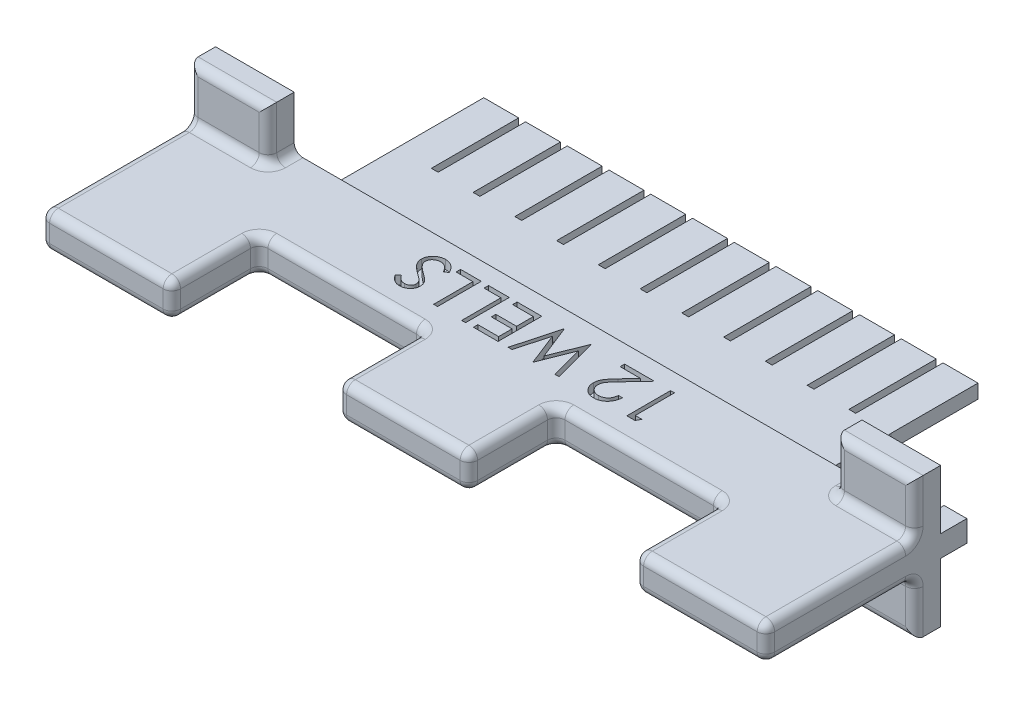
from build123d import *

# Parameters (mm, degrees)
SKETCH1_W           = 83
SKETCH1_H           = 4
BOSS_EXTRUDE1_DEPTH = 10
SKETCH2_W           = 15
SKETCH2_H           = 4
BOSS_EXTRUDE2_DEPTH = 10
SKETCH3_W           = 2.6
SKETCH3_H           = 2.45
BOSS_EXTRUDE3_DEPTH = 3
SKETCH4_W           = 56.6
SKETCH4_H           = 1.6
BOSS_EXTRUDE4_DEPTH = 7.5
SKETCH5_W           = 4
SKETCH5_H           = 1.6
BOSS_EXTRUDE5_DEPTH = 10
SKETCH6_W           = 9
SKETCH6_H           = 6
BOSS_EXTRUDE6_DEPTH = 3
FILLET1_R           = 1
CUT_EXTRUDE1_DEPTH  = 1


with BuildPart() as part:
    # Sketch1 → Boss-Extrude1 (new body)
    with BuildSketch(Plane.XY):
        Rectangle(SKETCH1_W, SKETCH1_H)
    extrude(amount=BOSS_EXTRUDE1_DEPTH)

    # Sketch2 → Boss-Extrude2 (add)
    with BuildSketch(Plane.XY.offset(10)):
        with Locations((-34, 0)):
            Rectangle(SKETCH2_W, SKETCH2_H)
        with Locations((34, 0)):
            Rectangle(SKETCH2_W, SKETCH2_H)
        Rectangle(SKETCH2_W, SKETCH2_H)
    extrude(amount=BOSS_EXTRUDE2_DEPTH)

    # Sketch3 → Boss-Extrude3 (add)
    with BuildSketch(Plane(origin=(0, 0, 0), x_dir=(-1, 0, 0), z_dir=(0, 0, -1))):
        with Locations((40.2, 0)):
            Rectangle(SKETCH3_W, SKETCH3_H)
        with Locations((-40.2, 0)):
            Rectangle(SKETCH3_W, SKETCH3_H)
    extrude(amount=BOSS_EXTRUDE3_DEPTH)

    # Sketch4 → Boss-Extrude4 (add)
    with BuildSketch(Plane(origin=(0, 0, 0), x_dir=(-1, 0, 0), z_dir=(0, 0, -1))):
        Rectangle(SKETCH4_W, SKETCH4_H)
    extrude(amount=BOSS_EXTRUDE4_DEPTH)

    # Sketch5 → Boss-Extrude5 (add)
    with BuildSketch(Plane(origin=(0, 0, -7.5), x_dir=(-1, 0, 0), z_dir=(0, 0, -1))):
        with Locations((26.3, 0)):
            Rectangle(SKETCH5_W, SKETCH5_H)
        with Locations((21.52, 0)):
            Rectangle(SKETCH5_W, SKETCH5_H)
        with Locations((16.74, 0)):
            Rectangle(SKETCH5_W, SKETCH5_H)
        with Locations((11.96, 0)):
            Rectangle(SKETCH5_W, SKETCH5_H)
        with Locations((7.18, 0)):
            Rectangle(SKETCH5_W, SKETCH5_H)
        with Locations((2.4, 0)):
            Rectangle(SKETCH5_W, SKETCH5_H)
        with Locations((-2.38, 0)):
            Rectangle(SKETCH5_W, SKETCH5_H)
        with Locations((-7.16, 0)):
            Rectangle(SKETCH5_W, SKETCH5_H)
        with Locations((-11.94, 0)):
            Rectangle(SKETCH5_W, SKETCH5_H)
        with Locations((-16.72, 0)):
            Rectangle(SKETCH5_W, SKETCH5_H)
        with Locations((-21.5, 0)):
            Rectangle(SKETCH5_W, SKETCH5_H)
        with Locations((-26.28, 0)):
            Rectangle(SKETCH5_W, SKETCH5_H)
    extrude(amount=BOSS_EXTRUDE5_DEPTH)

    # Sketch6 → Boss-Extrude6 (add)
    with BuildSketch(Plane(origin=(0, 0, 0), x_dir=(-1, 0, 0), z_dir=(0, 0, -1))):
        with Locations((37, -5)):
            Rectangle(SKETCH6_W, SKETCH6_H)
        with Locations((37, 5)):
            Rectangle(SKETCH6_W, SKETCH6_H)
        with Locations((-37, -5)):
            Rectangle(SKETCH6_W, SKETCH6_H)
        with Locations((-37, 5)):
            Rectangle(SKETCH6_W, SKETCH6_H)
    extrude(amount=-BOSS_EXTRUDE6_DEPTH)

    # Fillet1
    fillet1_edges = [part.edges().sort_by_distance(p)[0] for p in [
        (-41.5, -2, 11.5),
        (-32.5, -2, 1.5),
        (-37, -2, 3),
        (-32.5, -5, 3),
        (-37, -8, 3),
        (-41.5, -5, 3),
        (-26.5, 0, 20),
        (-34, -2, 20),
        (-41.5, 0, 20),
        (-34, 2, 20),
        (32.5, -2, 1.5),
        (41.5, -2, 11.5),
        (41.5, 2, 11.5),
        (32.5, 2, 1.5),
        (-32.5, 2, 1.5),
        (-41.5, 2, 11.5),
        (37, -8, 3),
        (32.5, -5, 3),
        (37, -2, 3),
        (41.5, -5, 3),
        (34, -2, 20),
        (26.5, 0, 20),
        (34, 2, 20),
        (41.5, 0, 20),
        (37, 2, 3),
        (32.5, 5, 3),
        (37, 8, 3),
        (41.5, 5, 3),
        (0, -2, 20),
        (-7.5, 0, 20),
        (0, 2, 20),
        (7.5, 0, 20),
        (-37, 8, 3),
        (-32.5, 5, 3),
        (-37, 2, 3),
        (-41.5, 5, 3),
        (26.5, 2, 15),
        (26.5, -2, 15),
        (26.5, 0, 10),
        (17, -2, 10),
        (17, 2, 10),
        (7.5, -2, 15),
        (7.5, 2, 15),
        (7.5, 0, 10),
        (-7.5, 2, 15),
        (-7.5, -2, 15),
        (-26.5, -2, 15),
        (-26.5, 2, 15),
        (-26.5, 0, 10),
        (-17, 2, 10),
        (-7.5, 0, 10),
        (-17, -2, 10),
    ]]
    fillet(fillet1_edges, radius=FILLET1_R)

    # Sketch8 → Cut-Extrude1 (cut)
    with BuildSketch(Plane(origin=(0, 2, 0), x_dir=(1, 0, 0), z_dir=(0, 1, 0))):
        Polygon((13.552684295, -7.045024133), (12.628205128, -7.045024133), (12.628205128, -2.045024133), (13.076923077, -2.045024133), (13.076923077, -6.53220362), (13.846153846, -6.53220362), align=None)
        with BuildLine():
            Line((10.128205128, -5.506562595), (10.576923077, -5.506562595))
            add(Edge.make_bspline(
                [(10.576923077, -5.506562595), (10.57399907, -5.566092728), (10.568256399, -5.683008325), (10.5413518, -5.853466896), (10.502890325, -6.016417351), (10.448381442, -6.170462688), (10.381067736, -6.317443109), (10.298656279, -6.455406883), (10.202903951, -6.585723285), (10.093986413, -6.705924992), (9.975800846, -6.815804382), (9.849055365, -6.911694974), (9.715052675, -6.99178619), (9.574955057, -7.059104705), (9.427142241, -7.109574069), (9.273027152, -7.147037958), (9.111913205, -7.169574394), (9.002141869, -7.17199711), (8.946314103, -7.173229261)],
                knots=[0, 0, 0, 0, 1.100776268, 2.161895295, 3.184016182, 4.190939212, 5.176500551, 6.166955529, 7.155448256, 8.160289653, 9.16017456, 10.133824356, 11.091467644, 12.04088621, 13.000931625, 13.972173743, 14.968683325, 16, 16, 16, 16], degree=3))
            add(Edge.make_bspline(
                [(8.946314103, -7.173229261), (8.891484424, -7.171956168), (8.783746065, -7.169454585), (8.626569197, -7.147648624), (8.47658477, -7.114232934), (8.335492555, -7.064716144), (8.201844549, -7.002583404), (8.077295538, -6.925313202), (7.958833795, -6.836561703), (7.852273217, -6.731874959), (7.75438447, -6.620173937), (7.670010289, -6.500878186), (7.597346581, -6.377522706), (7.537873605, -6.249143911), (7.492790445, -6.115323738), (7.459388144, -5.977345167), (7.440293583, -5.83361583), (7.437379152, -5.736317952), (7.435897436, -5.686851056)],
                knots=[0, 0, 0, 0, 1.111674182, 2.184400057, 3.212814286, 4.223731311, 5.211378316, 6.196328225, 7.191884489, 8.207283132, 9.220262353, 10.201199469, 11.166417575, 12.120932471, 13.06540007, 14.026332106, 14.996573967, 16, 16, 16, 16], degree=3))
            add(Edge.make_bspline(
                [(7.435897436, -5.686851056), (7.438316421, -5.617211323), (7.443111941, -5.479153934), (7.484131922, -5.276275119), (7.548200487, -5.079714765), (7.625332732, -4.921513227), (7.70316581, -4.794048875), (7.773234562, -4.68904921), (7.855728121, -4.576022551), (7.949941698, -4.454511424), (8.057497784, -4.326107119), (8.175602088, -4.188189845), (8.307304693, -4.043309786), (8.399659881, -3.944290287), (8.447516026, -3.892980864)],
                knots=[0, 0, 0, 0, 1.184416499, 2.348048165, 3.509039915, 4.696071444, 5.333504901, 6.05069495, 6.844171097, 7.714965912, 8.667477798, 9.695072654, 10.805644396, 12, 12, 12, 12], degree=3))
            Line((8.447516026, -3.892980864), (9.698517628, -2.557844646))
            Line((9.698517628, -2.557844646), (7.371794872, -2.557844646))
            Line((7.371794872, -2.557844646), (7.371794872, -2.045024133))
            Line((7.371794872, -2.045024133), (10.769230769, -2.045024133))
            Line((10.769230769, -2.045024133), (8.830128205, -4.114335031))
            add(Edge.make_bspline(
                [(8.830128205, -4.114335031), (8.782913596, -4.163615638), (8.692223994, -4.258273598), (8.564007146, -4.396513192), (8.448662561, -4.524609386), (8.346113726, -4.643129805), (8.256276263, -4.75140255), (8.179437613, -4.850276128), (8.115258162, -4.938902036), (8.047241318, -5.043016046), (7.982382745, -5.170283947), (7.925378695, -5.325029653), (7.890869219, -5.4846805), (7.886708342, -5.592535144), (7.884615385, -5.646786954)],
                knots=[0, 0, 0, 0, 1.329530082, 2.553755191, 3.672934919, 4.687409497, 5.60679272, 6.413407421, 7.126401618, 7.737995624, 8.834647426, 9.90044882, 10.943907757, 12, 12, 12, 12], degree=3))
            add(Edge.make_bspline(
                [(7.884615385, -5.646786954), (7.885514259, -5.680907007), (7.887285767, -5.748151081), (7.903216333, -5.846676643), (7.926621496, -5.942084544), (7.962696082, -6.033195133), (8.006038369, -6.121800379), (8.061411336, -6.205206405), (8.124688097, -6.286256324), (8.198086037, -6.362171001), (8.278663336, -6.431720633), (8.363800743, -6.493325149), (8.453871599, -6.544809938), (8.548500538, -6.587014841), (8.647422585, -6.620122554), (8.750829378, -6.643063375), (8.858435111, -6.657466925), (8.931911534, -6.659415742), (8.969350962, -6.660408749)],
                knots=[0, 0, 0, 0, 0.991504627, 1.954065223, 2.895985987, 3.842598665, 4.797835564, 5.759220273, 6.74786863, 7.784730864, 8.824135544, 9.839918996, 10.835834653, 11.835434876, 12.84861661, 13.863796685, 14.911511676, 16, 16, 16, 16], degree=3))
            add(Edge.make_bspline(
                [(8.969350962, -6.660408749), (9.008462139, -6.65942789), (9.085270034, -6.657501645), (9.197798698, -6.6429023), (9.305898727, -6.620792336), (9.407904331, -6.585593456), (9.505950304, -6.544397764), (9.597535447, -6.49105659), (9.685232498, -6.43010605), (9.767278283, -6.359041592), (9.842004264, -6.278820522), (9.909983158, -6.191501306), (9.967582349, -6.095535949), (10.018712569, -5.993227169), (10.057817093, -5.881764121), (10.091248659, -5.76387277), (10.115532863, -5.637871084), (10.123910882, -5.551059058), (10.128205128, -5.506562595)],
                knots=[0, 0, 0, 0, 1.031072318, 2.024855787, 2.988461151, 3.935103592, 4.865765533, 5.788564469, 6.724086513, 7.67908574, 8.64457978, 9.611397706, 10.591395687, 11.591555111, 12.622101007, 13.700900657, 14.821571223, 16, 16, 16, 16], degree=3))
        make_face()
        Polygon((4.871794872, -7.045024133), (4.408052885, -7.045024133), (3.429487179, -3.378157146), (1.974158654, -7.045024133), (1.909054487, -7.045024133), (0.480769231, -3.40319721), (-0.502804487, -7.045024133), (-0.961538462, -7.045024133), (0.38661859, -2.045024133), (0.450721154, -2.045024133), (1.955128205, -5.869142723), (3.477564103, -2.045024133), (3.541666667, -2.045024133), align=None)
        Polygon((-2.115384615, -7.045024133), (-4.935897436, -7.045024133), (-4.935897436, -6.53220362), (-2.564102564, -6.53220362), (-2.564102564, -4.993742082), (-4.935897436, -4.993742082), (-4.935897436, -4.480921569), (-2.564102564, -4.480921569), (-2.564102564, -2.557844646), (-4.935897436, -2.557844646), (-4.935897436, -2.045024133), (-2.115384615, -2.045024133), align=None)
        Polygon((-5.833333333, -7.045024133), (-6.282051282, -7.045024133), (-6.282051282, -2.557844646), (-8.205128205, -2.557844646), (-8.205128205, -2.045024133), (-5.833333333, -2.045024133), align=None)
        Polygon((-9.038461538, -7.045024133), (-9.487179487, -7.045024133), (-9.487179487, -2.557844646), (-11.41025641, -2.557844646), (-11.41025641, -2.045024133), (-9.038461538, -2.045024133), align=None)
        with BuildLine():
            Line((-11.730769231, -3.009567402), (-12.153445513, -3.262972851))
            add(Edge.make_bspline(
                [(-12.153445513, -3.262972851), (-12.19275728, -3.197166587), (-12.26807711, -3.071084324), (-12.393721909, -2.900715695), (-12.523911782, -2.755912614), (-12.65961083, -2.63751746), (-12.799990755, -2.544304765), (-12.945967975, -2.478301577), (-13.097050562, -2.437135898), (-13.199870307, -2.432135774), (-13.251201923, -2.429639518)],
                knots=[0, 0, 0, 0, 1.272034388, 2.437168799, 3.508375237, 4.49857839, 5.41946034, 6.295179144, 7.148887113, 8, 8, 8, 8], degree=3))
            add(Edge.make_bspline(
                [(-13.251201923, -2.429639518), (-13.295031425, -2.430889524), (-13.381923515, -2.433367665), (-13.510093304, -2.456217403), (-13.633949284, -2.493599407), (-13.752258746, -2.544275191), (-13.86189274, -2.606565217), (-13.959557889, -2.680022202), (-14.042078161, -2.764880154), (-14.110300045, -2.858079446), (-14.163705264, -2.957674629), (-14.20170435, -3.061212939), (-14.226114139, -3.168034604), (-14.22920895, -3.240474158), (-14.230769231, -3.276995287)],
                knots=[0, 0, 0, 0, 1.095645842, 2.172120455, 3.244862764, 4.326153987, 5.384857088, 6.392105572, 7.372507978, 8.334705661, 9.272564127, 10.189475455, 11.087205874, 12, 12, 12, 12], degree=3))
            add(Edge.make_bspline(
                [(-14.230769231, -3.276995287), (-14.228708308, -3.318638967), (-14.224534716, -3.40297196), (-14.187752567, -3.52760827), (-14.131587765, -3.65148293), (-14.078799163, -3.72812182), (-14.051482372, -3.767780543)],
                knots=[0, 0, 0, 0, 0.938992559, 1.901562324, 2.914110574, 4, 4, 4, 4], degree=3))
            add(Edge.make_bspline(
                [(-14.051482372, -3.767780543), (-14.029162446, -3.796481036), (-13.98216701, -3.856910995), (-13.900185198, -3.94528344), (-13.806966714, -4.03885355), (-13.700098095, -4.13575368), (-13.581137716, -4.237965999), (-13.448736901, -4.343594856), (-13.304441636, -4.454215663), (-13.202665983, -4.527277526), (-13.150040064, -4.565056185)],
                knots=[0, 0, 0, 0, 0.722283655, 1.520795216, 2.39349503, 3.346893347, 4.386874146, 5.510198126, 6.712579003, 8, 8, 8, 8], degree=3))
            add(Edge.make_bspline(
                [(-13.150040064, -4.565056185), (-13.097441372, -4.602534172), (-12.996876679, -4.674189229), (-12.856130845, -4.780398761), (-12.73044183, -4.878123265), (-12.619169188, -4.966001475), (-12.525191683, -5.047866194), (-12.445073758, -5.119329929), (-12.381771268, -5.184208764), (-12.346544926, -5.226263007), (-12.330729167, -5.245144326)],
                knots=[0, 0, 0, 0, 1.452255772, 2.776602448, 3.96446981, 5.032613149, 5.964194703, 6.766668629, 7.446264616, 8, 8, 8, 8], degree=3))
            add(Edge.make_bspline(
                [(-12.330729167, -5.245144326), (-12.308629235, -5.274575839), (-12.265166755, -5.332456861), (-12.207733954, -5.422900125), (-12.159300716, -5.51530739), (-12.120321016, -5.610013561), (-12.088799608, -5.706306865), (-12.066884144, -5.804910234), (-12.053375915, -5.905154288), (-12.051980553, -5.972599812), (-12.051282051, -6.006362274)],
                knots=[0, 0, 0, 0, 1.068019517, 2.100403715, 3.106014851, 4.09224787, 5.069873182, 6.043214339, 7.020455327, 8, 8, 8, 8], degree=3))
            add(Edge.make_bspline(
                [(-12.051282051, -6.006362274), (-12.053138419, -6.059266485), (-12.056811476, -6.163944115), (-12.088131424, -6.316779541), (-12.13698211, -6.463148887), (-12.207657854, -6.599794501), (-12.294955621, -6.726522677), (-12.398578237, -6.841085368), (-12.52046626, -6.939539184), (-12.656158757, -7.023232798), (-12.802950071, -7.090001634), (-12.957219134, -7.138653592), (-13.118272742, -7.167166609), (-13.227719371, -7.171188521), (-13.283253205, -7.173229261)],
                knots=[0, 0, 0, 0, 1.005367131, 1.989245246, 2.955191616, 3.932180104, 4.904534562, 5.875498653, 6.859376768, 7.874484044, 8.900379497, 9.918679785, 10.943926428, 12, 12, 12, 12], degree=3))
            add(Edge.make_bspline(
                [(-13.283253205, -7.173229261), (-13.342191557, -7.171262547), (-13.459073357, -7.167362316), (-13.631051248, -7.131365167), (-13.797619592, -7.075434995), (-13.931111047, -7.008823238), (-14.03562621, -6.943010929), (-14.115246444, -6.882914417), (-14.196369961, -6.813878112), (-14.278122688, -6.734439505), (-14.361312361, -6.646189546), (-14.445555592, -6.548380569), (-14.531640811, -6.441894176), (-14.587003214, -6.365855922), (-14.615384615, -6.326875095)],
                knots=[0, 0, 0, 0, 1.286534051, 2.551350862, 3.822568981, 5.117864672, 5.799956111, 6.519305446, 7.295594771, 8.126302591, 9.008831062, 9.944975596, 10.946496709, 12, 12, 12, 12], degree=3))
            Line((-14.615384615, -6.326875095), (-14.209735577, -6.019383108))
            add(Edge.make_bspline(
                [(-14.209735577, -6.019383108), (-14.185243174, -6.050940207), (-14.138076532, -6.111711801), (-14.066439221, -6.196789377), (-13.999021661, -6.274609563), (-13.932090714, -6.342024516), (-13.870805632, -6.404083282), (-13.810267784, -6.45627091), (-13.752815834, -6.500244196), (-13.680563611, -6.547233413), (-13.588803083, -6.592695827), (-13.474690207, -6.631782667), (-13.355360306, -6.655803848), (-13.274349871, -6.658856909), (-13.233173077, -6.660408749)],
                knots=[0, 0, 0, 0, 1.181426797, 2.275151783, 3.28963443, 4.225459815, 5.084396437, 5.868484344, 6.587427557, 7.222918358, 8.415355282, 9.605213164, 10.782753814, 12, 12, 12, 12], degree=3))
            add(Edge.make_bspline(
                [(-13.233173077, -6.660408749), (-13.181508713, -6.658706093), (-13.081878854, -6.655422682), (-12.940763152, -6.618619291), (-12.813018227, -6.562662214), (-12.70352072, -6.481972694), (-12.613110326, -6.385775243), (-12.546899331, -6.276068826), (-12.507312941, -6.154902356), (-12.502467636, -6.07042095), (-12.5, -6.027395928)],
                knots=[0, 0, 0, 0, 1.144248881, 2.206576175, 3.214949548, 4.222996039, 5.203671638, 6.127710127, 7.046472867, 8, 8, 8, 8], degree=3))
            add(Edge.make_bspline(
                [(-12.5, -6.027395928), (-12.500620232, -6.000621284), (-12.501869335, -5.946699014), (-12.516761678, -5.867196304), (-12.538985378, -5.788629526), (-12.570486859, -5.710546018), (-12.613297744, -5.630721251), (-12.671442442, -5.549610209), (-12.744202832, -5.465182894), (-12.800044516, -5.410325386), (-12.829527244, -5.381362274)],
                knots=[0, 0, 0, 0, 0.858500039, 1.728959331, 2.587258638, 3.476905708, 4.426389682, 5.487945037, 6.673710648, 8, 8, 8, 8], degree=3))
            add(Edge.make_bspline(
                [(-12.829527244, -5.381362274), (-12.840472061, -5.371595095), (-12.866474443, -5.348390511), (-12.91401148, -5.310401539), (-12.976786906, -5.263540436), (-13.053161479, -5.205558555), (-13.144543424, -5.138299323), (-13.25094279, -5.062622734), (-13.371173551, -4.976072079), (-13.456490574, -4.915561306), (-13.501602564, -4.8835658)],
                knots=[0, 0, 0, 0, 0.420754252, 0.999615792, 1.744751191, 2.668019286, 3.750313428, 4.999500688, 6.413464383, 8, 8, 8, 8], degree=3))
            add(Edge.make_bspline(
                [(-13.501602564, -4.8835658), (-13.555868116, -4.844078115), (-13.660945837, -4.767615687), (-13.810457183, -4.652736522), (-13.946017993, -4.540381275), (-14.06811424, -4.431274748), (-14.177918557, -4.32622016), (-14.274324052, -4.224035058), (-14.357768141, -4.125389559), (-14.448828501, -3.99977991), (-14.540772471, -3.844082152), (-14.619606868, -3.653237045), (-14.669759962, -3.461844272), (-14.676273465, -3.333371554), (-14.679487179, -3.269984069)],
                knots=[0, 0, 0, 0, 1.163604038, 2.253157948, 3.268574773, 4.215621239, 5.091738613, 5.902582348, 6.650434646, 7.330118262, 8.591011492, 9.77460283, 10.902005569, 12, 12, 12, 12], degree=3))
            add(Edge.make_bspline(
                [(-14.679487179, -3.269984069), (-14.678546932, -3.225158662), (-14.676684696, -3.136378326), (-14.655333465, -3.006001884), (-14.623939687, -2.879431158), (-14.577151037, -2.758241266), (-14.518663866, -2.641081534), (-14.447456202, -2.528157389), (-14.361160622, -2.421324295), (-14.265296586, -2.318507524), (-14.158815896, -2.225519919), (-14.046137586, -2.142697321), (-13.927894092, -2.071782763), (-13.802735095, -2.016070712), (-13.672722304, -1.971505835), (-13.53724543, -1.939562904), (-13.396013359, -1.919891418), (-13.300011283, -1.917854576), (-13.251201923, -1.916819005)],
                knots=[0, 0, 0, 0, 0.98378539, 1.948466333, 2.894822735, 3.844243623, 4.795447569, 5.768042124, 6.770299647, 7.807997672, 8.852593179, 9.870666288, 10.876941106, 11.874841786, 12.874492863, 13.892063892, 14.928283473, 16, 16, 16, 16], degree=3))
            add(Edge.make_bspline(
                [(-13.251201923, -1.916819005), (-13.213438814, -1.917557632), (-13.138388184, -1.919025584), (-13.027677186, -1.931695771), (-12.918999185, -1.95027676), (-12.813718731, -1.978606014), (-12.710525014, -2.013786535), (-12.610337414, -2.056859669), (-12.512914249, -2.108137258), (-12.418135174, -2.167698619), (-12.325132693, -2.236358883), (-12.234282151, -2.315634394), (-12.145128754, -2.40514569), (-12.057302169, -2.504768208), (-11.972871263, -2.616148638), (-11.88971285, -2.737520615), (-11.80825994, -2.869276248), (-11.757081922, -2.961930236), (-11.730769231, -3.009567402)],
                knots=[0, 0, 0, 0, 0.915366252, 1.81920441, 2.69897508, 3.586533125, 4.459536084, 5.340758185, 6.227946952, 7.126403341, 8.052553006, 9.028121456, 10.047063623, 11.114014537, 12.24582441, 13.433687931, 14.680555077, 16, 16, 16, 16], degree=3))
        make_face()
    extrude(amount=-CUT_EXTRUDE1_DEPTH, mode=Mode.SUBTRACT)


solid = part.part
